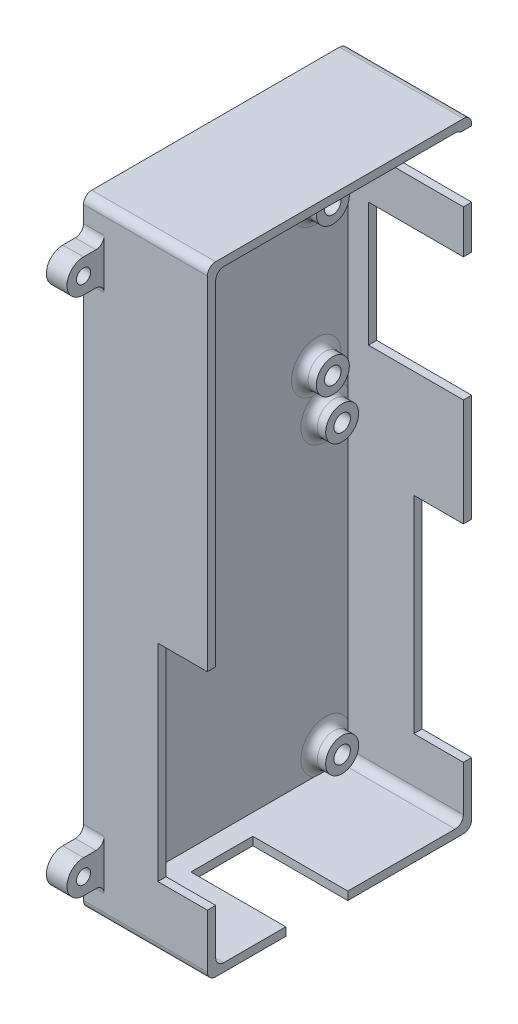
from build123d import *

# Parameters (mm, degrees)
SKETCH1_W                                = 150
SKETCH1_H                                = 64
BOSS_EXTRUDE1_DEPTH                      = 30
SHELL1_T                                 = -2
SKETCH2_R                                = 4
SKETCH2_R_2                              = 5
MOUNT_BOSS_DEPTH                         = 4
SKETCH3_R                                = 2
SKETCH3_R_2                              = 2.5
M2_5_INSERT_RECESS_DEPTH                 = 4
FILLET1_R                                = 2
SKETCH4_W                                = 2
SKETCH4_H                                = 15
SKETCH4_W_2                              = 30
SKETCH4_H_2                              = 2
SKETCH4_W_3                              = 16
CUT_EXTRUDE2_DEPTH                       = 23
SKETCH5_W                                = 50
SKETCH5_H                                = 2
CUT_EXTRUDE3_DEPTH                       = 12
FILLET2_R                                = 2
MOUNT_TAB_DEPTH                          = 5
M3_CLEARANCE_HOLE1_D                     = 3.4
MIRROR2_AT_THE_SECOND_PLANE_COPY_1_DEPTH = 5
MIRROR2_AT_THE_SECOND_PLANE_COPY_2_D     = 3.4
FILLET3_R                                = 2


with BuildPart() as part:
    # Sketch1 → Boss-Extrude1 (new body)
    with BuildSketch(Plane.YZ):
        Rectangle(SKETCH1_W, SKETCH1_H)
    extrude(amount=BOSS_EXTRUDE1_DEPTH)

    # Shell1
    shell1_openings = [part.faces().sort_by_distance(p)[0] for p in [
        (30, 0, 0),
    ]]
    offset(amount=SHELL1_T, openings=shell1_openings, kind=Kind.INTERSECTION)

    # Sketch2 → Mount boss (add)
    with BuildSketch(Plane.YZ.offset(2)):
        with Locations(Location((-67.698, 24.892, 0), (0, 0, 270))):
            Circle(SKETCH2_R)
        with Locations(Location((1.898, 24.892, 0), (0, 0, 270))):
            Circle(SKETCH2_R)
        with Locations(Location((1.898, -24.638, 0), (0, 0, 270))):
            Circle(SKETCH2_R)
        with Locations(Location((-67.698, -24.638, 0), (0, 0, 270))):
            Circle(SKETCH2_R)
        with Locations(Location((12.915, 22.375, 0), (0, 0, 270))):
            Circle(SKETCH2_R)
        with Locations(Location((48.665, 22.375, 0), (0, 0, 270))):
            Circle(SKETCH2_R)
        with Locations(Location((12.915, -22.375, 0), (0, 0, 270))):
            Circle(SKETCH2_R)
        with Locations(Location((48.665, -22.375, 0), (0, 0, 270))):
            Circle(SKETCH2_R)
        with Locations(Location((64.18, -9.4, 0), (0, 0, 270))):
            Circle(SKETCH2_R_2)
    extrude(amount=MOUNT_BOSS_DEPTH)

    # Sketch3 → M2.5 insert recess (cut)
    with BuildSketch(Plane.YZ.offset(6)):
        with Locations(Location((-67.698, 24.892, 0), (0, 0, 270))):
            Circle(SKETCH3_R)
        with Locations(Location((1.898, 24.892, 0), (0, 0, 270))):
            Circle(SKETCH3_R)
        with Locations(Location((1.898, -24.638, 0), (0, 0, 270))):
            Circle(SKETCH3_R)
        with Locations(Location((-67.698, -24.638, 0), (0, 0, 270))):
            Circle(SKETCH3_R)
        with Locations(Location((12.915, 22.375, 0), (0, 0, 270))):
            Circle(SKETCH3_R)
        with Locations(Location((48.665, 22.375, 0), (0, 0, 270))):
            Circle(SKETCH3_R)
        with Locations(Location((48.665, -22.375, 0), (0, 0, 270))):
            Circle(SKETCH3_R)
        with Locations(Location((12.915, -22.375, 0), (0, 0, 270))):
            Circle(SKETCH3_R)
        with Locations(Location((64.18, -9.4, 0), (0, 0, 270))):
            Circle(SKETCH3_R_2)
    extrude(amount=-M2_5_INSERT_RECESS_DEPTH, mode=Mode.SUBTRACT)

    # Fillet1
    # the kernel refuses this fillet: 2 mm, written as the material it adds along each edge
    with BuildSketch(Plane(origin=(2, 12.915, 22.375), x_dir=(0, 0, -1), z_dir=(0, -1, 0))) as fillet1_piece_1:
        with BuildLine():
            CenterArc((4 + FILLET1_R, FILLET1_R), FILLET1_R, 180, 90)
            Line((4, FILLET1_R), (4, 0))
            Line((4, 0), (4 + FILLET1_R, 0))
        make_face()
    revolve(axis=Axis((2, 12.915, 22.375), (1, 0, 0)))
    with BuildSketch(Plane(origin=(2, -67.698, -24.638), x_dir=(0, 0, -1), z_dir=(0, -1, 0))) as fillet1_piece_2:
        with BuildLine():
            CenterArc((4 + FILLET1_R, FILLET1_R), FILLET1_R, 180, 90)
            Line((4, FILLET1_R), (4, 0))
            Line((4, 0), (4 + FILLET1_R, 0))
        make_face()
    revolve(axis=Axis((2, -67.698, -24.638), (1, 0, 0)))
    with BuildSketch(Plane(origin=(2, 1.898, -24.638), x_dir=(0, 0, -1), z_dir=(0, -1, 0))) as fillet1_piece_3:
        with BuildLine():
            CenterArc((4 + FILLET1_R, FILLET1_R), FILLET1_R, 180, 90)
            Line((4, FILLET1_R), (4, 0))
            Line((4, 0), (4 + FILLET1_R, 0))
        make_face()
    revolve(axis=Axis((2, 1.898, -24.638), (1, 0, 0)))
    with BuildSketch(Plane(origin=(2, 1.898, 24.892), x_dir=(0, 0, -1), z_dir=(0, -1, 0))) as fillet1_piece_4:
        with BuildLine():
            CenterArc((4 + FILLET1_R, FILLET1_R), FILLET1_R, 180, 90)
            Line((4, FILLET1_R), (4, 0))
            Line((4, 0), (4 + FILLET1_R, 0))
        make_face()
    revolve(axis=Axis((2, 1.898, 24.892), (1, 0, 0)))
    with BuildSketch(Plane(origin=(2, 64.18, -9.4), x_dir=(0, 0, -1), z_dir=(0, -1, 0))) as fillet1_piece_5:
        with BuildLine():
            CenterArc((5 + FILLET1_R, FILLET1_R), FILLET1_R, 180, 90)
            Line((5, FILLET1_R), (5, 0))
            Line((5, 0), (5 + FILLET1_R, 0))
        make_face()
    revolve(axis=Axis((2, 64.18, -9.4), (1, 0, 0)))
    with BuildSketch(Plane(origin=(2, 48.665, -22.375), x_dir=(0, 0, -1), z_dir=(0, -1, 0))) as fillet1_piece_6:
        with BuildLine():
            CenterArc((4 + FILLET1_R, FILLET1_R), FILLET1_R, 180, 90)
            Line((4, FILLET1_R), (4, 0))
            Line((4, 0), (4 + FILLET1_R, 0))
        make_face()
    revolve(axis=Axis((2, 48.665, -22.375), (1, 0, 0)))
    with BuildSketch(Plane(origin=(2, 12.915, -22.375), x_dir=(0, 0, -1), z_dir=(0, -1, 0))) as fillet1_piece_7:
        with BuildLine():
            CenterArc((4 + FILLET1_R, FILLET1_R), FILLET1_R, 180, 90)
            Line((4, FILLET1_R), (4, 0))
            Line((4, 0), (4 + FILLET1_R, 0))
        make_face()
    revolve(axis=Axis((2, 12.915, -22.375), (1, 0, 0)))
    with BuildSketch(Plane(origin=(2, 48.665, 22.375), x_dir=(0, 0, -1), z_dir=(0, -1, 0))) as fillet1_piece_8:
        with BuildLine():
            CenterArc((4 + FILLET1_R, FILLET1_R), FILLET1_R, 180, 90)
            Line((4, FILLET1_R), (4, 0))
            Line((4, 0), (4 + FILLET1_R, 0))
        make_face()
    revolve(axis=Axis((2, 48.665, 22.375), (1, 0, 0)))
    with BuildSketch(Plane(origin=(2, -67.698, 24.892), x_dir=(0, 0, -1), z_dir=(0, -1, 0))) as fillet1_piece_9:
        with BuildLine():
            CenterArc((4 + FILLET1_R, FILLET1_R), FILLET1_R, 180, 90)
            Line((4, FILLET1_R), (4, 0))
            Line((4, 0), (4 + FILLET1_R, 0))
        make_face()
    revolve(axis=Axis((2, -67.698, 24.892), (1, 0, 0)))

    # Sketch4 → Cut-Extrude2 (cut)
    with BuildSketch(Plane.YZ.offset(30)):
        with Locations((-74, 5.5)):
            Rectangle(SKETCH4_W, SKETCH4_H)
        with Locations((31, -31)):
            Rectangle(SKETCH4_W_2, SKETCH4_H_2)
        with Locations((64.5, -31)):
            Rectangle(SKETCH4_W_3, SKETCH4_H_2)
    extrude(amount=-CUT_EXTRUDE2_DEPTH, mode=Mode.SUBTRACT)

    # Sketch5 → Cut-Extrude3 (cut)
    with BuildSketch(Plane.YZ.offset(30)):
        with Locations((-35, 31)):
            Rectangle(SKETCH5_W, SKETCH5_H)
    cut_extrude3 = extrude(amount=-CUT_EXTRUDE3_DEPTH, mode=Mode.SUBTRACT)

    # Mirror1: Cut-Extrude3 across plane
    add(cut_extrude3.mirror(Plane.XY), mode=Mode.SUBTRACT)

    # Fillet2
    fillet2_edges = [part.edges().sort_by_distance(p)[0] for p in [
        (15, 75, 32),
        (15, -75, 32),
        (15, -75, -32),
        (15, 75, -32),
        (16, 73, -30),
        (16, -73, -30),
        (16, 73, 30),
        (16, -73, 30),
    ]]
    fillet(fillet2_edges, radius=FILLET2_R)

    # Sketch6 → Mount tab (add)
    with BuildSketch(Plane(origin=(0, 0, 0), x_dir=(0, -1, 0), z_dir=(-1, 0, 0))):
        with BuildLine():
            Line((59, 32), (67, 32))
            Line((67, 32), (67, 37))
            ThreePointArc((67, 37), (63, 41), (59, 37))
            Line((59, 37), (59, 32))
        make_face()
    mount_tab = extrude(amount=-MOUNT_TAB_DEPTH)

    # M3 Clearance Hole1 (through all)
    with Locations(Plane.YZ.offset(5)):
        with Locations((-63, 37)):
            m3_clearance_hole1 = Hole(M3_CLEARANCE_HOLE1_D / 2)

    # Mirror2: Mount tab, M3 Clearance Hole1 across plane
    add(mount_tab.mirror(Plane.ZX))
    add(m3_clearance_hole1.mirror(Plane.ZX), mode=Mode.SUBTRACT)

    # Mirror2 at the second plane: Mount tab, M3 Clearance Hole1 across plane
    add(mount_tab.mirror(Plane.XY))
    add(m3_clearance_hole1.mirror(Plane.XY), mode=Mode.SUBTRACT)

    # Mirror2 at the second plane copy 1 sketc → Mirror2 at the second plane copy 1 (add)
    with BuildSketch(Plane(origin=(0, 0, 0), x_dir=(0, 1, 0), z_dir=(-1, 0, 0))):
        with BuildLine():
            Line((59, 32), (67, 32))
            Line((67, 32), (67, 37))
            ThreePointArc((67, 37), (63, 41), (59, 37))
            Line((59, 37), (59, 32))
        make_face()
    extrude(amount=-MIRROR2_AT_THE_SECOND_PLANE_COPY_1_DEPTH)

    # Mirror2 at the second plane copy 2 (through all)
    with Locations(Plane(origin=(5, 0, 0), x_dir=(0, -1, 0), z_dir=(1, 0, 0))):
        with Locations((-63, 37)):
            Hole(MIRROR2_AT_THE_SECOND_PLANE_COPY_2_D / 2)

    # Fillet3
    fillet3_edges = [part.edges().sort_by_distance(p)[0] for p in [
        (2.5, -67, 32),
        (2.5, -59, 32),
        (2.5, -67, -32),
        (2.5, -59, -32),
        (2.5, 67, 32),
        (2.5, 59, 32),
        (2.5, 67, -32),
        (2.5, 59, -32),
    ]]
    fillet(fillet3_edges, radius=FILLET3_R)


solid = part.part
